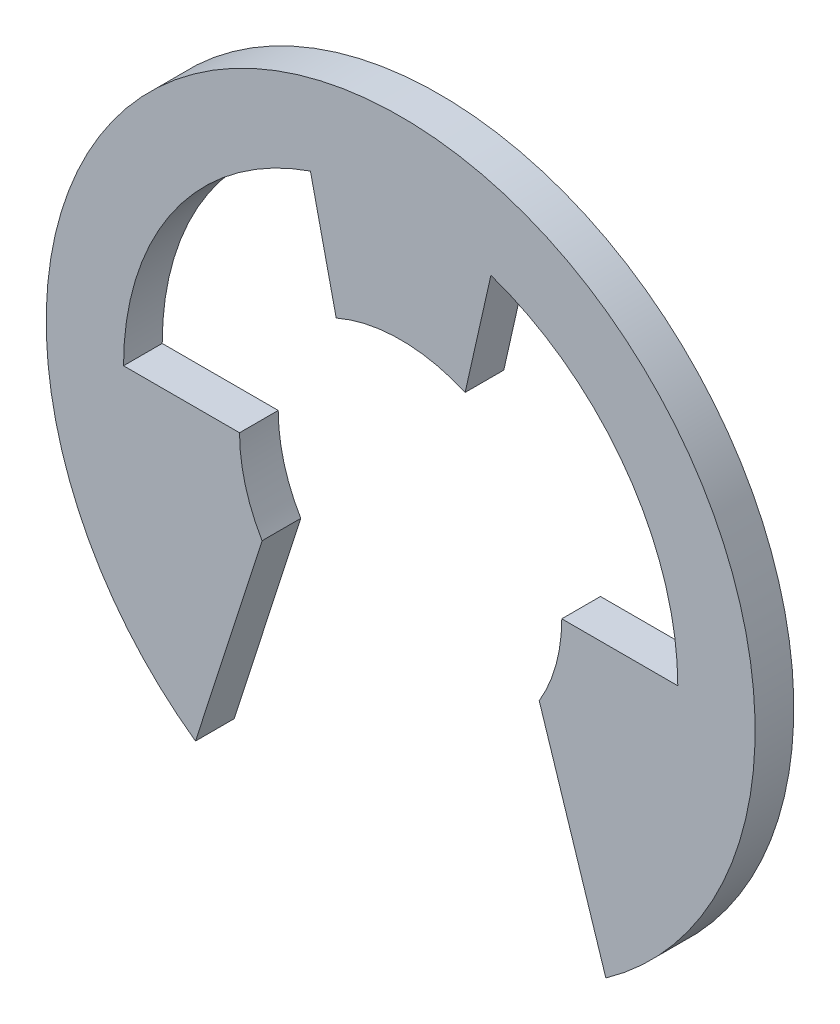
from build123d import *

# Parameters (mm, degrees)
EXTRUDE_1_DEPTH      = 0.3
EXTRUDE_1_DEPTH_BACK = 0.3


with BuildPart() as part:
    # ｽｹｯﾁ1 → ﾎﾞｽ - 押し出し1 (new, two sides: drawn at the far end of the back side and taken through both)
    with BuildSketch(Plane.XY.offset(-EXTRUDE_1_DEPTH_BACK)):
        with BuildLine():
            Line((-3.183480549, -4.485025261), (-2.15, -1.275735082))
            ThreePointArc((-2.15, -1.275735082), (-2.41091269, -0.661437828), (-2.5, 0))
            Line((-2.5, 0), (-4.3, 0))
            ThreePointArc((-4.3, 0), (-3.500714213, 2.496998198), (-1.4, 4.06571027))
            Line((-1.4, 4.06571027), (-1.000106191, 2.291241499))
            ThreePointArc((-1.000106191, 2.291241499), (0, 2.5), (1.000106191, 2.291241499))
            Line((1.000106191, 2.291241499), (1.4, 4.06571027))
            ThreePointArc((1.4, 4.06571027), (3.500714213, 2.496998198), (4.3, 0))
            Line((4.3, 0), (2.5, 0))
            ThreePointArc((2.5, 0), (2.41091269, -0.661437828), (2.15, -1.275735082))
            Line((2.15, -1.275735082), (3.183480549, -4.485025261))
            ThreePointArc((3.183480549, -4.485025261), (0, 5.5), (-3.183480549, -4.485025261))
        make_face()
    extrude(amount=EXTRUDE_1_DEPTH + EXTRUDE_1_DEPTH_BACK)


solid = part.part
